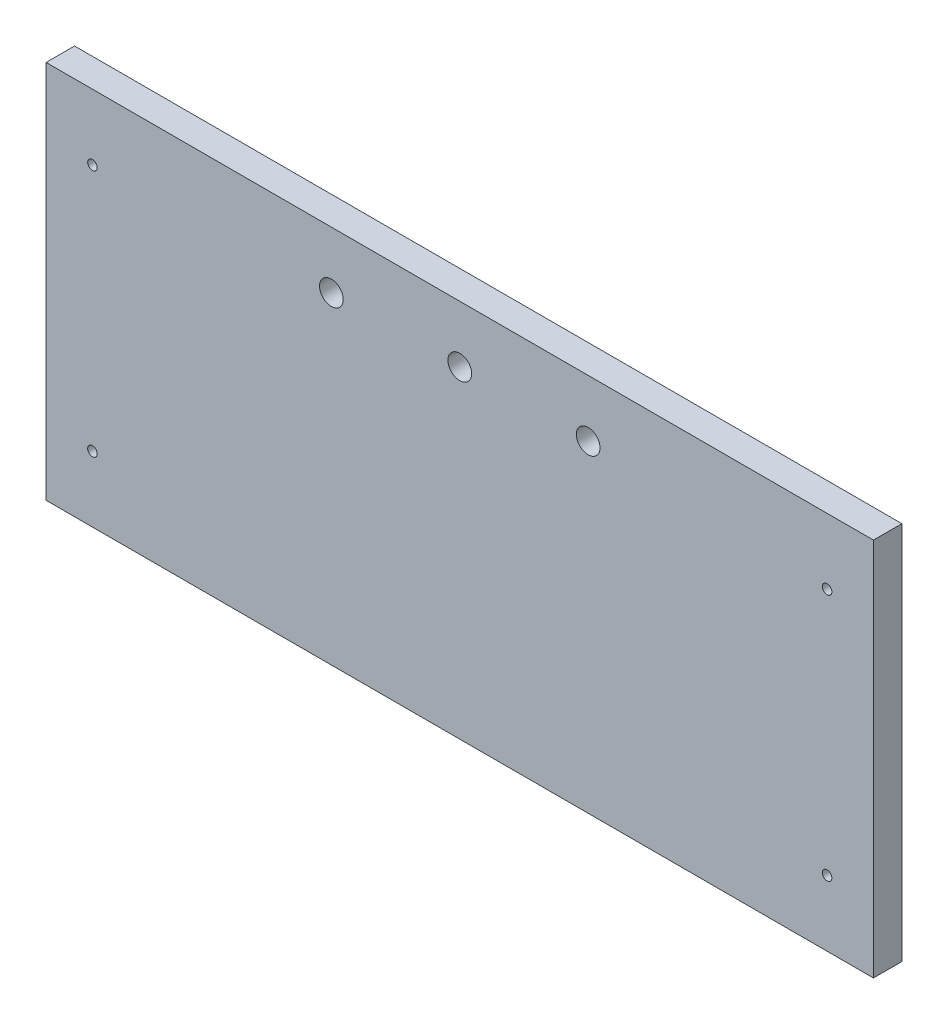
from build123d import *

# Parameters (mm, degrees)
SKETCH1_W        = 277.05
SKETCH1_H        = 127
SKETCH1_R        = 1.6
WALL_DEPTH       = 9.525
RODCUTOUTS_REACH = 306.92
SKETCH2_R        = 3.97


with BuildPart() as part:
    # Sketch1 → Wall (new body)
    with BuildSketch(Plane.XY):
        with Locations((138.525, 63.5)):
            Rectangle(SKETCH1_W, SKETCH1_H)
        with Locations((15.525, 105)):
            Circle(SKETCH1_R, mode=Mode.SUBTRACT)
        with Locations((15.525, 22)):
            Circle(SKETCH1_R, mode=Mode.SUBTRACT)
        with Locations((261.525, 105)):
            Circle(SKETCH1_R, mode=Mode.SUBTRACT)
        with Locations((261.525, 22)):
            Circle(SKETCH1_R, mode=Mode.SUBTRACT)
    extrude(amount=WALL_DEPTH)

    # Sketch2 → RodCutouts (cut, up to next)
    with BuildSketch(Plane.XY.offset(9.525), mode=Mode.PRIVATE) as rodcutouts_sk1:
        with Locations((138.525, 107.95)):
            Circle(SKETCH2_R)
    rodcutouts_tool1 = extrude(rodcutouts_sk1.sketch, amount=-RODCUTOUTS_REACH, mode=Mode.PRIVATE) & part.part
    # Sketch2 → RodCutouts (cut, up to next)
    with BuildSketch(Plane.XY.offset(9.525), mode=Mode.PRIVATE) as rodcutouts_sk2:
        with Locations((95.53, 107.95)):
            Circle(SKETCH2_R)
    rodcutouts_tool2 = extrude(rodcutouts_sk2.sketch, amount=-RODCUTOUTS_REACH, mode=Mode.PRIVATE) & part.part
    # Sketch2 → RodCutouts (cut, up to next)
    with BuildSketch(Plane.XY.offset(9.525), mode=Mode.PRIVATE) as rodcutouts_sk3:
        with Locations((181.52, 107.95)):
            Circle(SKETCH2_R)
    rodcutouts_tool3 = extrude(rodcutouts_sk3.sketch, amount=-RODCUTOUTS_REACH, mode=Mode.PRIVATE) & part.part
    add(rodcutouts_tool1.solids().sort_by_distance((138.525, 107.95, 9.525))[0], mode=Mode.SUBTRACT)
    add(rodcutouts_tool2.solids().sort_by_distance((95.53, 107.95, 9.525))[0], mode=Mode.SUBTRACT)
    add(rodcutouts_tool3.solids().sort_by_distance((181.52, 107.95, 9.525))[0], mode=Mode.SUBTRACT)


solid = part.part
